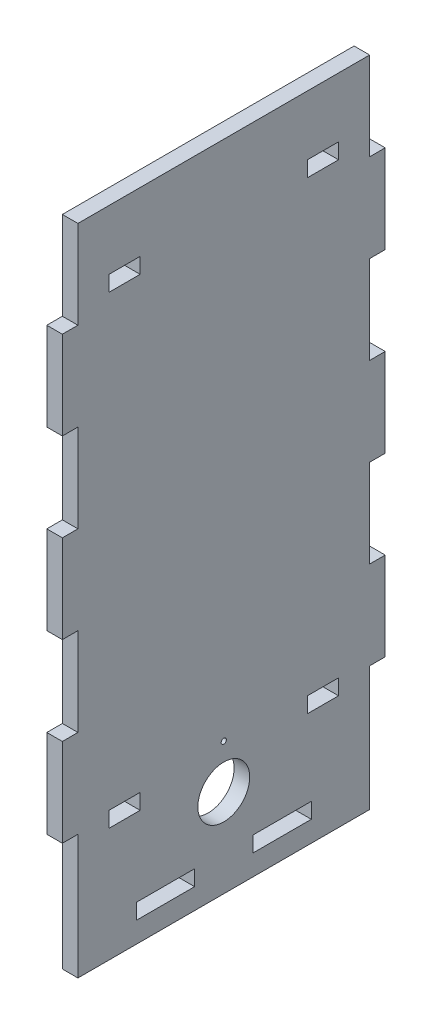
from build123d import *

# Parameters (mm, degrees)
SKETCH1_W           = 112.5
SKETCH1_H           = 238
BOSS_EXTRUDE1_DEPTH = 6
SKETCH2_R           = 10
SKETCH2_R_2         = 1
CUT_EXTRUDE1_DEPTH  = 6
SKETCH3_W           = 12
SKETCH3_H           = 6
CUT_EXTRUDE2_DEPTH  = 6
SKETCH4_W           = 6
SKETCH4_H           = 22.5
BOSS_EXTRUDE2_DEPTH = 6
SKETCH5_W           = 12
SKETCH5_H           = 6
CUT_EXTRUDE3_DEPTH  = 6
SKETCH6_W           = 6
SKETCH6_H           = 34
BOSS_EXTRUDE3_DEPTH = 6
SKETCH7_W           = 6
SKETCH7_H           = 112.5
BOSS_EXTRUDE4_DEPTH = 8


with BuildPart() as part:
    # Sketch1 → Boss-Extrude1 (new body)
    with BuildSketch(Plane(origin=(0, 0, 0), x_dir=(0, 0, -1), z_dir=(1, 0, 0))):
        Rectangle(SKETCH1_W, SKETCH1_H)
    extrude(amount=BOSS_EXTRUDE1_DEPTH)

    # Sketch2 → Cut-Extrude1 (cut)
    with BuildSketch(Plane(origin=(6, 0, 0), x_dir=(0, 0, -1), z_dir=(1, 0, 0))):
        with Locations((0, -99)):
            Circle(SKETCH2_R)
        with Locations((0, -82.029437252)):
            Circle(SKETCH2_R_2)
    extrude(amount=-CUT_EXTRUDE1_DEPTH, mode=Mode.SUBTRACT)

    # Sketch3 → Cut-Extrude2 (cut)
    with BuildSketch(Plane(origin=(6, 0, 0), x_dir=(0, 0, -1), z_dir=(1, 0, 0))):
        with Locations((38.25, -86)):
            Rectangle(SKETCH3_W, SKETCH3_H)
        with Locations((-38.25, -86)):
            Rectangle(SKETCH3_W, SKETCH3_H)
    extrude(amount=-CUT_EXTRUDE2_DEPTH, mode=Mode.SUBTRACT)

    # Sketch4 → Boss-Extrude2 (add)
    with BuildSketch(Plane.XZ.offset(119)):
        with Locations((3, -45)):
            Rectangle(SKETCH4_W, SKETCH4_H)
        with Locations((3, 0)):
            Rectangle(SKETCH4_W, SKETCH4_H)
        with Locations((3, 45)):
            Rectangle(SKETCH4_W, SKETCH4_H)
    extrude(amount=BOSS_EXTRUDE2_DEPTH)

    # Sketch5 → Cut-Extrude3 (cut)
    with BuildSketch(Plane(origin=(6, 0, 0), x_dir=(0, 0, -1), z_dir=(1, 0, 0))):
        with Locations((-38.25, 93)):
            Rectangle(SKETCH5_W, SKETCH5_H)
        with Locations((38.25, 93)):
            Rectangle(SKETCH5_W, SKETCH5_H)
    extrude(amount=-CUT_EXTRUDE3_DEPTH, mode=Mode.SUBTRACT)

    # Sketch6 → Boss-Extrude3 (add)
    with BuildSketch(Plane(origin=(0, 0, -56.25), x_dir=(-1, 0, 0), z_dir=(0, 0, -1))):
        with Locations((-3, 68)):
            Rectangle(SKETCH6_W, SKETCH6_H)
        with Locations((-3, 0)):
            Rectangle(SKETCH6_W, SKETCH6_H)
        with Locations((-3, -68)):
            Rectangle(SKETCH6_W, SKETCH6_H)
    boss_extrude3 = extrude(amount=BOSS_EXTRUDE3_DEPTH)

    # Mirror1: Boss-Extrude3 across plane
    add(boss_extrude3.mirror(Plane.XY))

    # Sketch7 → Boss-Extrude4 (add)
    with BuildSketch(Plane(origin=(0, -125, 0), x_dir=(-1, 0, 0), z_dir=(0, -1, 0))):
        with Locations((-3, 0)):
            Rectangle(SKETCH7_W, SKETCH7_H)
    extrude(amount=BOSS_EXTRUDE4_DEPTH)


solid = part.part
